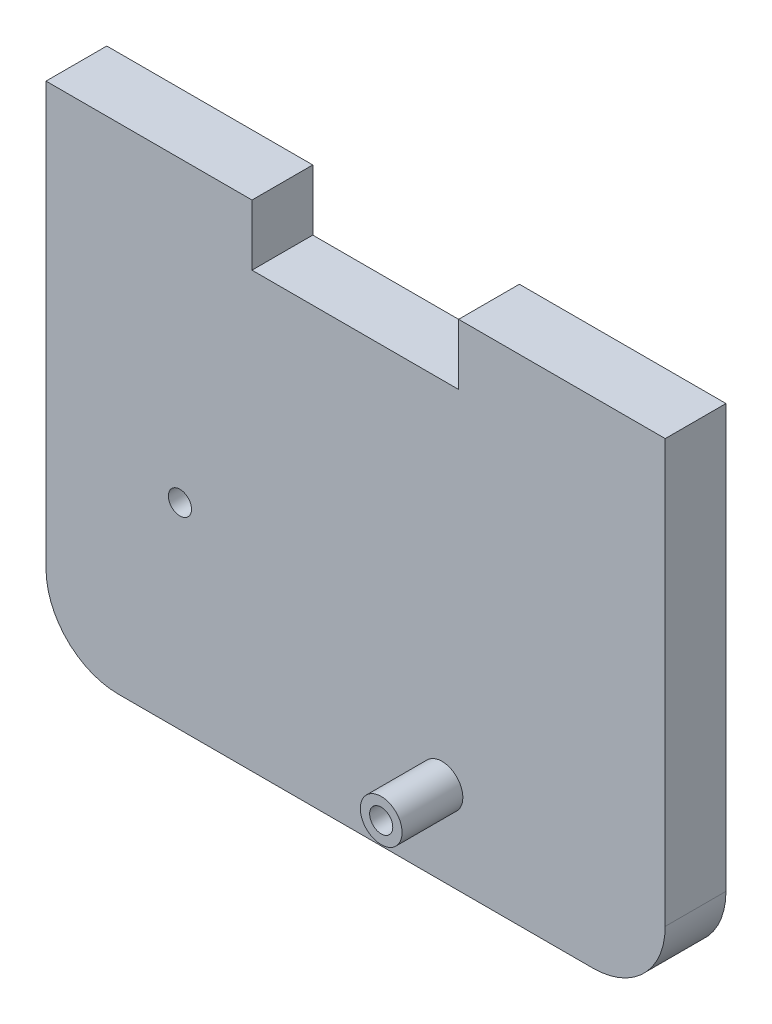
from build123d import *

# Parameters (mm, degrees)
SKETCH1_W           = 54.356
SKETCH1_H           = 43.434
BOSS_EXTRUDE1_DEPTH = 5.334
SKETCH2_W           = 18.137033298
SKETCH2_H           = 5.334
CUT_EXTRUDE1_DEPTH  = 41.016719041
FILLET1_R           = 6.35
SKETCH3_R           = 1.5
CUT_EXTRUDE3_DEPTH  = 41.016719041
SKETCH4_R           = 2.129802381
SKETCH4_R_2         = 1.016
BOSS_EXTRUDE2_DEPTH = 5.334
SKETCH5_R           = 1.83349768
SKETCH5_R_2         = 1.016
BOSS_EXTRUDE3_DEPTH = 5.334


with BuildPart() as part:
    # Sketch1 → Boss-Extrude1 (new body)
    with BuildSketch(Plane.XY):
        with Locations((-3.35450847, 3.594107707)):
            Rectangle(SKETCH1_W, SKETCH1_H)
    extrude(amount=BOSS_EXTRUDE1_DEPTH)

    # Sketch2 → Cut-Extrude1 (cut, through all)
    with BuildSketch(Plane.XY.offset(5.334)):
        with Locations((-3.382058417, 22.644107707)):
            Rectangle(SKETCH2_W, SKETCH2_H)
    extrude(amount=-CUT_EXTRUDE1_DEPTH, mode=Mode.SUBTRACT)

    # Fillet1
    fillet1_edges = [part.edges().sort_by_distance(p)[0] for p in [
        (-30.53250847, -18.122892293, 2.667),
        (23.82349153, -18.122892293, 2.667),
    ]]
    fillet(fillet1_edges, radius=FILLET1_R)

    # Sketch3 → Cut-Extrude3 (cut, through all)
    with BuildSketch(Plane.XY.offset(5.334)):
        with Locations((-18.775410686, -0.856094215)):
            Circle(SKETCH3_R)
        with Locations((4.224589314, -10.856094215)):
            Circle(SKETCH3_R)
    extrude(amount=-CUT_EXTRUDE3_DEPTH, mode=Mode.SUBTRACT)

    # Sketch4 → Boss-Extrude2 (add)
    with BuildSketch(Plane.XY.offset(5.334)):
        with Locations((-18.775410686, -0.856094215)):
            Circle(SKETCH4_R)
        with Locations((-18.775410686, -0.856094215)):
            Circle(SKETCH4_R_2, mode=Mode.SUBTRACT)
    extrude(amount=-BOSS_EXTRUDE2_DEPTH)

    # Sketch5 → Boss-Extrude3 (add)
    with BuildSketch(Plane.XY.offset(5.334)):
        with Locations((4.224589314, -10.856094215)):
            Circle(SKETCH5_R)
        with Locations((4.224589314, -10.856094215)):
            Circle(SKETCH5_R_2, mode=Mode.SUBTRACT)
    extrude(amount=BOSS_EXTRUDE3_DEPTH)


solid = part.part
